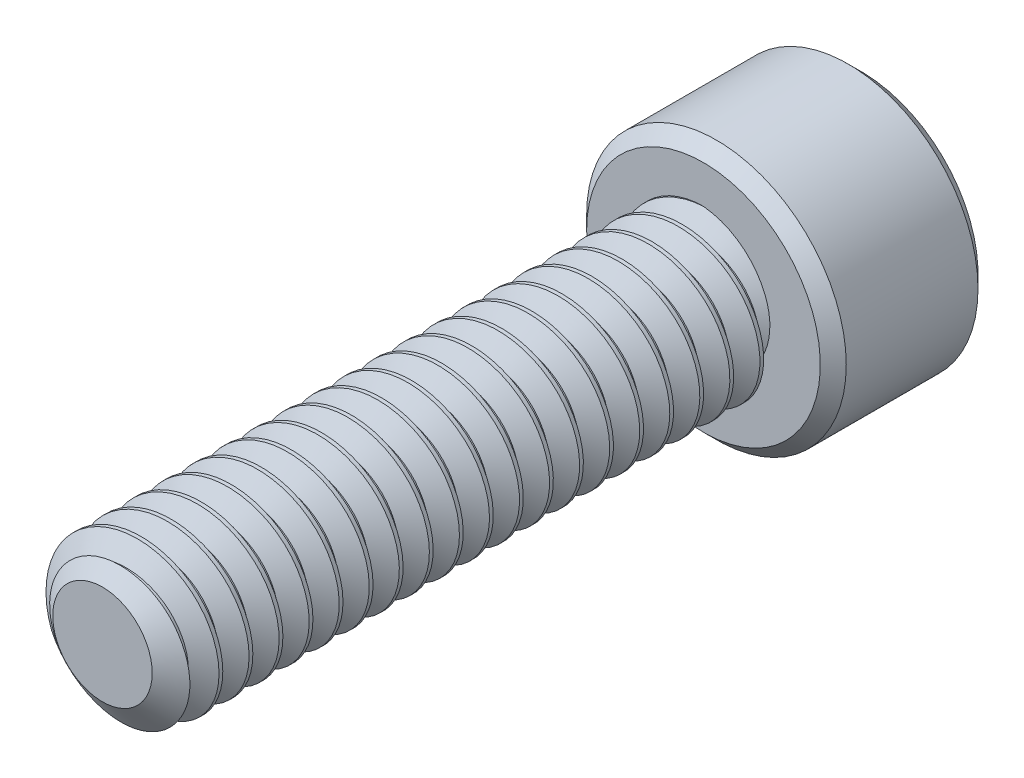
from build123d import *

# Parameters (mm, degrees)
SKETCH1_R          = 2.0828
EXTRUDE1_DEPTH     = 15.875
CUT_SWEEP1_PITCH   = 0.79375
SKETCH6_R          = 3.429
EXTRUDE2_DEPTH     = 4.1656
CUT_EXTRUDE1_DEPTH = 2.67890625
CHAMFER1_SIZE      = 0.3429


with BuildPart() as part:
    # Sketch1 → Extrude1 (new body)
    with BuildSketch(Plane.XY):
        Circle(SKETCH1_R)
    extrude(amount=-EXTRUDE1_DEPTH)

    # Cut-Sweep1: the profile of Sketch3 profile screwed along a right-hand helix of 21 turns, 6 arcs to a turn; built about Z, then put on its axis
    cut_sweep1_z = Axis((0, 0, 0), (0, 0, 1))
    cut_sweep1_corners = [(2.0831, 0, -0.694704455), (1.567244252, 0, -0.396875), (1.567244252, 0, -0.29765625), (2.0831, 0, 0.000173205)]
    with BuildLine(mode=Mode.PRIVATE) as cut_sweep1_profile:
        Line(cut_sweep1_corners[0], cut_sweep1_corners[1])
        Line(cut_sweep1_corners[1], cut_sweep1_corners[2])
        Line(cut_sweep1_corners[2], cut_sweep1_corners[3])
        Line(cut_sweep1_corners[3], cut_sweep1_corners[0])
    cut_sweep1_cap = Face(cut_sweep1_profile.wire())
    cut_sweep1_turn_angles = [0, 30, 60, 90, 120, 150, 180, 210, 240, 270, 300, 330, 360]
    cut_sweep1_turn_weights = [1, 0.8660254037844387, 1, 0.8660254037844387, 1, 0.8660254037844387, 1, 0.8660254037844387, 1, 0.8660254037844387, 1, 0.8660254037844387, 1]
    cut_sweep1_turn_rails = [Edge.make_bspline([Vector(p[0], p[1], 0).rotate(cut_sweep1_z, cut_sweep1_turn_angles[k]) / cut_sweep1_turn_weights[k] + Vector(0, 0, p[2] + CUT_SWEEP1_PITCH * cut_sweep1_turn_angles[k] / 360) for k in range(13)], [0, 0, 0, 1, 1, 2, 2, 3, 3, 4, 4, 5, 5, 6, 6, 6], 2, cut_sweep1_turn_weights) for p in cut_sweep1_corners]
    cut_sweep1_turn_sides = [Face.make_surface_from_curves(cut_sweep1_turn_rails[p[0]], cut_sweep1_turn_rails[p[1]]) for p in [(0, 1), (1, 2), (2, 3), (3, 0)]]
    cut_sweep1 = Plane(origin=(0, 0, 0), x_dir=(0, 1, 0), z_dir=(0, 0, -1)) * Solid(Shell([*[p.moved(Location((0, 0, CUT_SWEEP1_PITCH * i))) for i in range(21) for p in cut_sweep1_turn_sides], cut_sweep1_cap, cut_sweep1_cap.rotate(cut_sweep1_z, 7560).moved(Location((0, 0, CUT_SWEEP1_PITCH * 7560 / 360)))]))
    add(cut_sweep1, mode=Mode.SUBTRACT)

    # Sketch4 → Cut-Revolve1 (revolve, cut)
    with BuildSketch(Plane(origin=(0, 0, 0), x_dir=(0, 0, -1), z_dir=(1, 0, 0)), mode=Mode.PRIVATE) as cut_revolve1_sk:
        Polygon((0.538848736, 2.0828), (0, 1.313244252), (0, 2.0828), align=None)
    revolve(cut_revolve1_sk.sketch.rotate(Axis((0, 0, 0), (0, 0, -1)), 261.048315518), axis=Axis((0, 0, 0), (0, 0, -1)), mode=Mode.SUBTRACT)

    # Sketch6 → Extrude2 (add)
    with BuildSketch(Plane(origin=(0, 0, -15.875), x_dir=(-1, 0, 0), z_dir=(0, 0, -1))):
        Circle(SKETCH6_R)
    extrude(amount=EXTRUDE2_DEPTH)

    # Sketch7 → Cut-Extrude1 (cut)
    with BuildSketch(Plane(origin=(0, 0, -20.0406), x_dir=(-1, 0, 0), z_dir=(0, 0, -1))):
        Polygon((0, 2.062222993), (-1.7859375, 1.031111496), (-1.7859375, -1.031111496), (0, -2.062222993), (1.7859375, -1.031111496), (1.7859375, 1.031111496), align=None)
    extrude(amount=-CUT_EXTRUDE1_DEPTH, mode=Mode.SUBTRACT)

    # Cut-Extrude2 cone 1 section (through the dimple's axis) → Cut-Extrude2 (revolve, cut)
    with BuildSketch(Plane(origin=(0, 0, -20.0406), x_dir=(0, 1, 0), z_dir=(1, 0, 0))):
        Polygon((0, 0), (2.062222993, 0), (0, 2.062222993), align=None)
    revolve(axis=Axis((0, 0, -20.0406), (0, 0, 1)), mode=Mode.SUBTRACT)

    # Chamfer1
    chamfer1_edges = [part.edges().sort_by_distance(p)[0] for p in [
        (3.429, 0, -15.875),
        (3.429, 0, -20.0406),
    ]]
    chamfer(chamfer1_edges, length=CHAMFER1_SIZE)


solid = part.part
